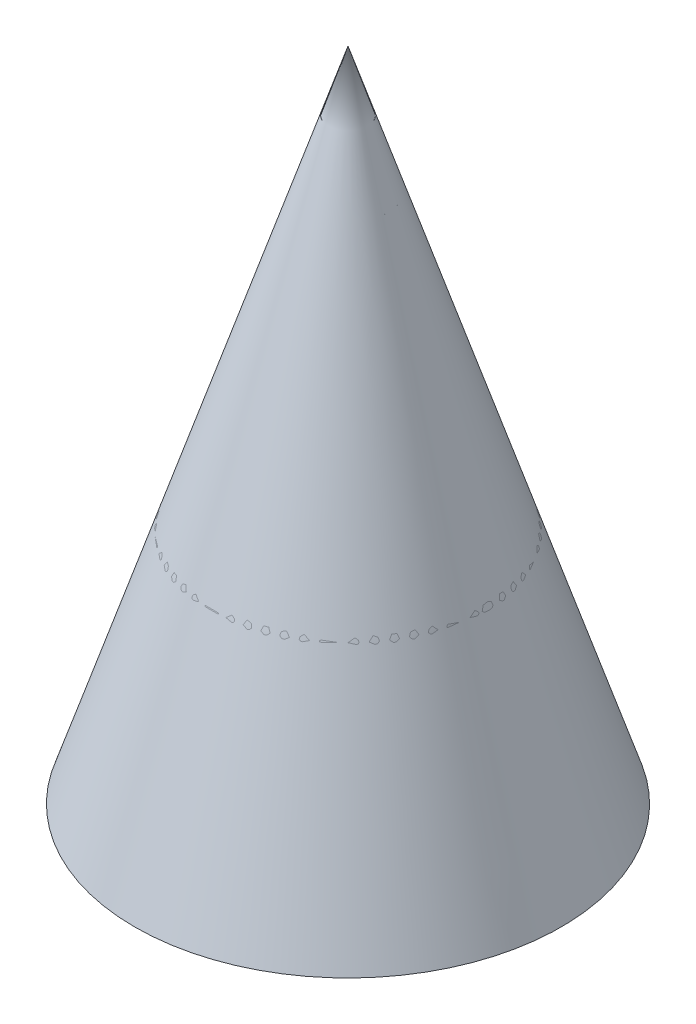
from build123d import *


with BuildPart() as part:
    # 草图1 → 旋转1 (revolve)
    with BuildSketch(Plane.XY):
        Polygon((0, 0), (0, 230), (74.731530134, 0), align=None)
    revolve(axis=Axis((0, 118.33598762, 0), (0, -1, 0)))

    # 草图2 → 切除-旋转1 (revolve, cut)
    with BuildSketch(Plane.XY):
        with BuildLine():
            Line((0, 196.453980338), (0, 166.463980338))
            ThreePointArc((0, 166.463980338), (14.995, 181.458980338), (0, 196.453980338))
        make_face()
        with BuildLine():
            Line((0, 118.191601125), (0, 18.201601125))
            ThreePointArc((0, 18.201601125), (49.995, 68.196601125), (0, 118.191601125))
        make_face()
    revolve(axis=Axis((0, 230, 0), (0, -1, 0)), mode=Mode.SUBTRACT)


solid = part.part
